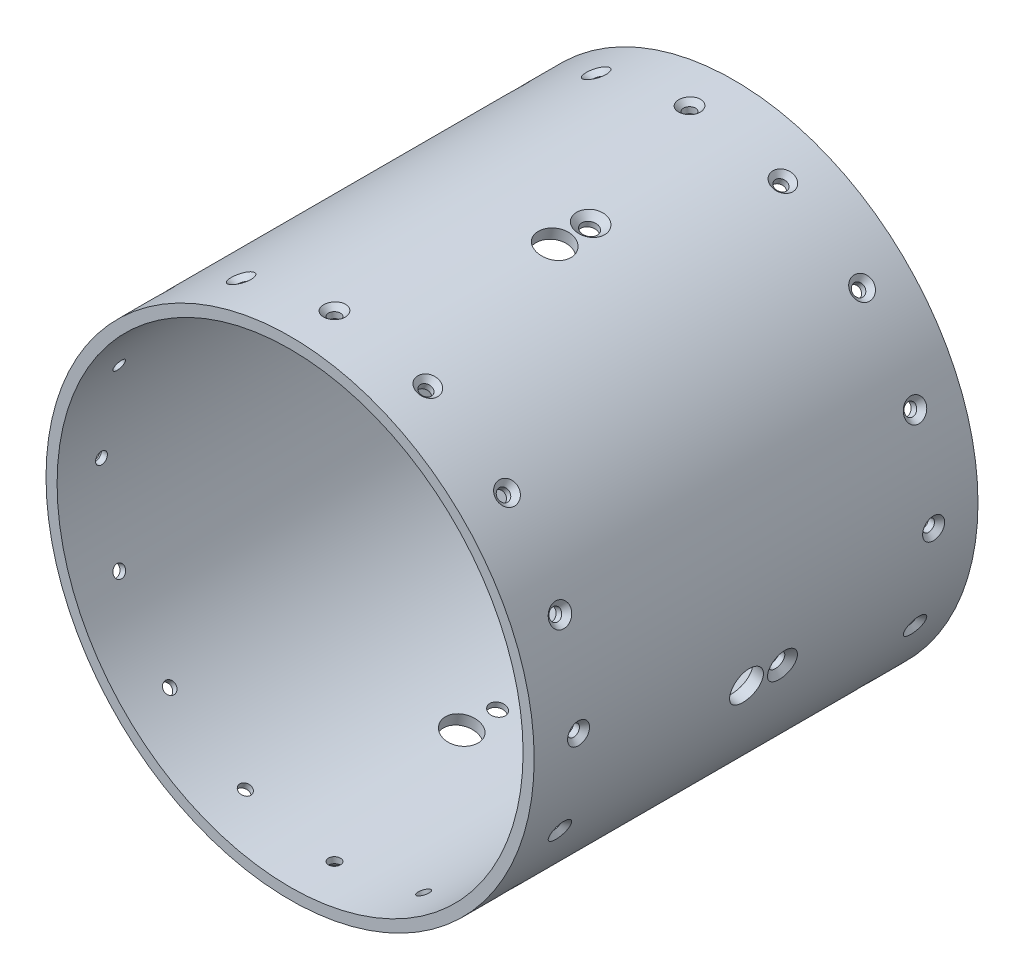
from build123d import *

# Parameters (mm, degrees)
SKETCH1_R         = 69.85
SKETCH1_R_2       = 66.675
EXTRUDE1_DEPTH    = 127
CIRPATTERN1_COUNT = 16
CIRPATTERN2_COUNT = 4


with BuildPart() as part:
    # Sketch1 → Extrude1 (new body)
    with BuildSketch(Plane.XY):
        Circle(SKETCH1_R)
        Circle(SKETCH1_R_2, mode=Mode.SUBTRACT)
    extrude(amount=EXTRUDE1_DEPTH)

    # Sketch12 → CSK for M3 Flat Head Machine Screw2 (revolve, cut)
    with BuildSketch(Plane(origin=(69.85, 0, 114.3), x_dir=(0, 0, -1), z_dir=(0, 1, 0))):
        Polygon((0, 0), (0, 13.213463052), (1.7, 12.192), (1.7, 1.45), (3.15, 0), align=None)
    csk_for_m3_flat_head_machine_screw2 = revolve(axis=Axis((76.2, 0, 114.3), (-1, 0, 0)), mode=Mode.SUBTRACT)

    # Sketch30 → CSK for M3 Flat Head Machine Screw1 (revolve, cut)
    with BuildSketch(Plane(origin=(69.85, 0, 12.7), x_dir=(0, 0, -1), z_dir=(0, 1, 0))):
        Polygon((0, 0), (0, 13.213463052), (1.7, 12.192), (1.7, 1.45), (3.15, 0), align=None)
    csk_for_m3_flat_head_machine_screw1 = revolve(axis=Axis((76.2, 0, 12.7), (-1, 0, 0)), mode=Mode.SUBTRACT)

    # CirPattern1: CSK for M3 Flat Head Machine Screw2, CSK for M3 Flat Head Machine Screw1 ×16 about axis
    cirpattern1_axis = Axis((0, 0, 127), (0, 0, -1))
    add([csk_for_m3_flat_head_machine_screw2.rotate(cirpattern1_axis, i * 360 / CIRPATTERN1_COUNT) for i in range(1, CIRPATTERN1_COUNT)], mode=Mode.SUBTRACT)
    add([csk_for_m3_flat_head_machine_screw1.rotate(cirpattern1_axis, i * 360 / CIRPATTERN1_COUNT) for i in range(1, CIRPATTERN1_COUNT)], mode=Mode.SUBTRACT)

    # Sketch32 → 3/8 (0.375) Diameter Hole1 (revolve, cut)
    with BuildSketch(Plane(origin=(68.507851836, -13.627058993, 64.890747868), x_dir=(0.19509032201612853, 0.9807852804032304, 0), z_dir=(0, 0, 1))):
        Polygon((0, 0), (0, 15.561598698), (4.7625, 12.7), (4.7625, 0), align=None)
    f_3_8_0_375_diameter_hole1 = revolve(axis=Axis((74.735838367, -14.865882538, 64.890747868), (-0.9807852804032304, 0.19509032201612855, 0)), mode=Mode.SUBTRACT)

    # Sketch22 → CSK for #8 Flat Head Machine Screw (100)2 (revolve, cut)
    with BuildSketch(Plane(origin=(68.507851836, -13.627058993, 54.61), x_dir=(0.19509032201612853, 0.9807852804032304, 0), z_dir=(0, 0, 1))):
        Polygon((0, 0), (0, 13.542674586), (2.2479, 12.192), (2.2479, 1.651767624), (4.2164, 0), align=None)
    csk_for_8_flat_head_machine_screw_100 = revolve(axis=Axis((74.735838367, -14.865882538, 54.61), (-0.9807852804032304, 0.19509032201612855, 0)), mode=Mode.SUBTRACT)

    # CirPattern2: 3/8 (0.375) Diameter Hole1, CSK for #8 Flat Head Machine Screw (100)2 ×4 about axis
    cirpattern2_axis = Axis((0, 0, 127), (0, 0, -1))
    add([f_3_8_0_375_diameter_hole1.rotate(cirpattern2_axis, i * 360 / CIRPATTERN2_COUNT) for i in range(1, CIRPATTERN2_COUNT)], mode=Mode.SUBTRACT)
    add([csk_for_8_flat_head_machine_screw_100.rotate(cirpattern2_axis, i * 360 / CIRPATTERN2_COUNT) for i in range(1, CIRPATTERN2_COUNT)], mode=Mode.SUBTRACT)


solid = part.part
